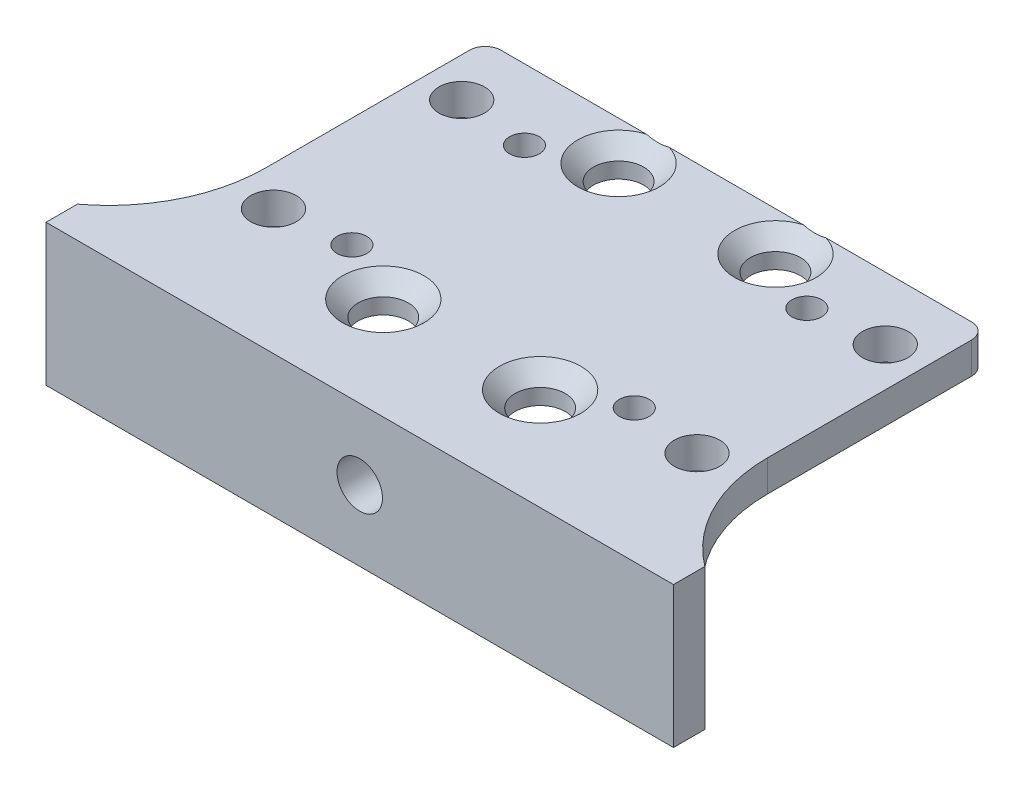
from build123d import *

# Parameters (mm, degrees)
SKETCH1_W           = 32
SKETCH1_H           = 20
SKETCH1_R           = 1.6
BOSS_EXTRUDE1_DEPTH = 2
SKETCH3_W           = 40
SKETCH3_H           = 9
SKETCH3_R           = 1.45
BOSS_EXTRUDE2_DEPTH = 4
CUT_EXTRUDE1_DEPTH  = 2
FILLET1_R           = 10
CHAMFER1_SIZE       = 1
CUT_EXTRUDE2_REACH  = 28.019
SKETCH12_R          = 1.45
SKETCH12_R_2        = 0.95
FILLET2_R           = 1


with BuildPart() as part:
    # Sketch1 → Boss-Extrude1 (new body)
    with BuildSketch(Plane(origin=(0, 0, 0), x_dir=(1, 0, 0), z_dir=(0, 1, 0))):
        Rectangle(SKETCH1_W, SKETCH1_H)
        with Locations(Location((-5, 7.5, 0), (0, 0, 270))):
            Circle(SKETCH1_R, mode=Mode.SUBTRACT)
        with Locations(Location((5, 7.5, 0), (0, 0, 270))):
            Circle(SKETCH1_R, mode=Mode.SUBTRACT)
        with Locations(Location((-5, -7.5, 0), (0, 0, 270))):
            Circle(SKETCH1_R, mode=Mode.SUBTRACT)
        with Locations(Location((5, -7.5, 0), (0, 0, 270))):
            Circle(SKETCH1_R, mode=Mode.SUBTRACT)
    extrude(amount=BOSS_EXTRUDE1_DEPTH)

    # Sketch3 → Boss-Extrude2 (add)
    with BuildSketch(Plane.XY.offset(10)):
        with Locations((0, -2.5)):
            Rectangle(SKETCH3_W, SKETCH3_H)
        with Locations((0, -2.5)):
            Circle(SKETCH3_R, mode=Mode.SUBTRACT)
    extrude(amount=BOSS_EXTRUDE2_DEPTH)

    # Sketch4 → Cut-Extrude1 (cut)
    with BuildSketch(Plane(origin=(0, 0, 10), x_dir=(-1, 0, 0), z_dir=(0, 0, -1))):
        with BuildLine():
            Line((-16, 2), (-20, 2))
            Line((-20, 2), (-20, -7))
            Line((-20, -7), (20, -7))
            Line((20, -7), (20, 2))
            Line((20, 2), (16, 2))
            Line((16, 2), (16, 0))
            Line((16, 0), (4, 0))
            Line((4, 0), (4, -2.5))
            ThreePointArc((4, -2.5), (0, -6.5), (-4, -2.5))
            Line((-4, -2.5), (-4, 0))
            Line((-4, 0), (-16, 0))
            Line((-16, 0), (-16, 2))
        make_face()
    extrude(amount=-CUT_EXTRUDE1_DEPTH, mode=Mode.SUBTRACT)

    # Fillet1
    # the kernel refuses this fillet: 10 mm, written as the material it adds along each edge
    with BuildSketch(Plane(origin=(16, 0, 12), x_dir=(0, 0, -1), z_dir=(0, 1, 0)), Plane(origin=(-16, 2, 12), x_dir=(0, 0, -1), z_dir=(0, -1, 0))) as fillet1_piece_1:
        with BuildLine():
            CenterArc((8, -10), FILLET1_R, 90, 53.130102354)
            Line((0, -4), (-0.16, -3.88))
            ThreePointArc((-0.16, -3.88), (-0.2, -2), (-0.2, 0))
            Line((-0.2, 0), (0, 0.2))
            Line((0, 0.2), (8, 0.2))
            Line((8, 0.2), (8, 0))
        make_face()
    extrude(amount=2)

    # Chamfer1
    # the kernel refuses this chamfer: 1 mm, written as the material it takes off along each edge
    with BuildSketch(Plane(origin=(-5, 2, -7.5), x_dir=(0, 0, 1), z_dir=(-1, 0, 0))) as chamfer1_piece_1:
        Polygon((1.6 + CHAMFER1_SIZE, 0), (1.6, -CHAMFER1_SIZE), (1.6, 0), align=None)
    revolve(axis=Axis((-5, 2, -7.5), (0, 1, 0)), mode=Mode.SUBTRACT)
    with BuildSketch(Plane(origin=(5, 2, -7.5), x_dir=(0, 0, 1), z_dir=(-1, 0, 0))) as chamfer1_piece_2:
        Polygon((1.6 + CHAMFER1_SIZE, 0), (1.6, -CHAMFER1_SIZE), (1.6, 0), align=None)
    revolve(axis=Axis((5, 2, -7.5), (0, 1, 0)), mode=Mode.SUBTRACT)
    with BuildSketch(Plane(origin=(-5, 2, 7.5), x_dir=(0, 0, 1), z_dir=(-1, 0, 0))) as chamfer1_piece_3:
        Polygon((1.6 + CHAMFER1_SIZE, 0), (1.6, -CHAMFER1_SIZE), (1.6, 0), align=None)
    revolve(axis=Axis((-5, 2, 7.5), (0, 1, 0)), mode=Mode.SUBTRACT)
    with BuildSketch(Plane(origin=(5, 2, 7.5), x_dir=(0, 0, 1), z_dir=(-1, 0, 0))) as chamfer1_piece_4:
        Polygon((1.6 + CHAMFER1_SIZE, 0), (1.6, -CHAMFER1_SIZE), (1.6, 0), align=None)
    revolve(axis=Axis((5, 2, 7.5), (0, 1, 0)), mode=Mode.SUBTRACT)

    # Sketch12 → Cut-Extrude2 (cut, up to next)
    with BuildSketch(Plane(origin=(0, 2, 0), x_dir=(1, 0, 0), z_dir=(0, 1, 0)), mode=Mode.PRIVATE) as cut_extrude2_sk1:
        with Locations(Location((-13.5, 6, 0), (0, 0, 270))):
            Circle(SKETCH12_R)
    cut_extrude2_tool1 = extrude(cut_extrude2_sk1.sketch, amount=-CUT_EXTRUDE2_REACH, mode=Mode.PRIVATE) & part.part
    # Sketch12 → Cut-Extrude2 (cut, up to next)
    with BuildSketch(Plane(origin=(0, 2, 0), x_dir=(1, 0, 0), z_dir=(0, 1, 0)), mode=Mode.PRIVATE) as cut_extrude2_sk2:
        with Locations(Location((-13.5, -6, 0), (0, 0, 270))):
            Circle(SKETCH12_R)
    cut_extrude2_tool2 = extrude(cut_extrude2_sk2.sketch, amount=-CUT_EXTRUDE2_REACH, mode=Mode.PRIVATE) & part.part
    # Sketch12 → Cut-Extrude2 (cut, up to next)
    with BuildSketch(Plane(origin=(0, 2, 0), x_dir=(1, 0, 0), z_dir=(0, 1, 0)), mode=Mode.PRIVATE) as cut_extrude2_sk3:
        with Locations(Location((13.5, -6, 0), (0, 0, 270))):
            Circle(SKETCH12_R)
    cut_extrude2_tool3 = extrude(cut_extrude2_sk3.sketch, amount=-CUT_EXTRUDE2_REACH, mode=Mode.PRIVATE) & part.part
    # Sketch12 → Cut-Extrude2 (cut, up to next)
    with BuildSketch(Plane(origin=(0, 2, 0), x_dir=(1, 0, 0), z_dir=(0, 1, 0)), mode=Mode.PRIVATE) as cut_extrude2_sk4:
        with Locations(Location((13.5, 6, 0), (0, 0, 270))):
            Circle(SKETCH12_R)
    cut_extrude2_tool4 = extrude(cut_extrude2_sk4.sketch, amount=-CUT_EXTRUDE2_REACH, mode=Mode.PRIVATE) & part.part
    # Sketch12 → Cut-Extrude2 (cut, up to next)
    with BuildSketch(Plane(origin=(0, 2, 0), x_dir=(1, 0, 0), z_dir=(0, 1, 0)), mode=Mode.PRIVATE) as cut_extrude2_sk5:
        with Locations(Location((-9, 5.5, 0), (0, 0, 270))):
            Circle(SKETCH12_R_2)
    cut_extrude2_tool5 = extrude(cut_extrude2_sk5.sketch, amount=-CUT_EXTRUDE2_REACH, mode=Mode.PRIVATE) & part.part
    # Sketch12 → Cut-Extrude2 (cut, up to next)
    with BuildSketch(Plane(origin=(0, 2, 0), x_dir=(1, 0, 0), z_dir=(0, 1, 0)), mode=Mode.PRIVATE) as cut_extrude2_sk6:
        with Locations(Location((9, 5.5, 0), (0, 0, 270))):
            Circle(SKETCH12_R_2)
    cut_extrude2_tool6 = extrude(cut_extrude2_sk6.sketch, amount=-CUT_EXTRUDE2_REACH, mode=Mode.PRIVATE) & part.part
    # Sketch12 → Cut-Extrude2 (cut, up to next)
    with BuildSketch(Plane(origin=(0, 2, 0), x_dir=(1, 0, 0), z_dir=(0, 1, 0)), mode=Mode.PRIVATE) as cut_extrude2_sk7:
        with Locations(Location((9, -5.5, 0), (0, 0, 270))):
            Circle(SKETCH12_R_2)
    cut_extrude2_tool7 = extrude(cut_extrude2_sk7.sketch, amount=-CUT_EXTRUDE2_REACH, mode=Mode.PRIVATE) & part.part
    # Sketch12 → Cut-Extrude2 (cut, up to next)
    with BuildSketch(Plane(origin=(0, 2, 0), x_dir=(1, 0, 0), z_dir=(0, 1, 0)), mode=Mode.PRIVATE) as cut_extrude2_sk8:
        with Locations(Location((-9, -5.5, 0), (0, 0, 270))):
            Circle(SKETCH12_R_2)
    cut_extrude2_tool8 = extrude(cut_extrude2_sk8.sketch, amount=-CUT_EXTRUDE2_REACH, mode=Mode.PRIVATE) & part.part
    add(cut_extrude2_tool1.solids().sort_by_distance((-13.5, 2, -6))[0], mode=Mode.SUBTRACT)
    add(cut_extrude2_tool2.solids().sort_by_distance((-13.5, 2, 6))[0], mode=Mode.SUBTRACT)
    add(cut_extrude2_tool3.solids().sort_by_distance((13.5, 2, 6))[0], mode=Mode.SUBTRACT)
    add(cut_extrude2_tool4.solids().sort_by_distance((13.5, 2, -6))[0], mode=Mode.SUBTRACT)
    add(cut_extrude2_tool5.solids().sort_by_distance((-9, 2, -5.5))[0], mode=Mode.SUBTRACT)
    add(cut_extrude2_tool6.solids().sort_by_distance((9, 2, -5.5))[0], mode=Mode.SUBTRACT)
    add(cut_extrude2_tool7.solids().sort_by_distance((9, 2, 5.5))[0], mode=Mode.SUBTRACT)
    add(cut_extrude2_tool8.solids().sort_by_distance((-9, 2, 5.5))[0], mode=Mode.SUBTRACT)

    # Fillet2
    fillet2_edges = [part.edges().sort_by_distance(p)[0] for p in [
        (-16, 1, -10),
        (16, 1, -10),
    ]]
    fillet(fillet2_edges, radius=FILLET2_R)


solid = part.part
